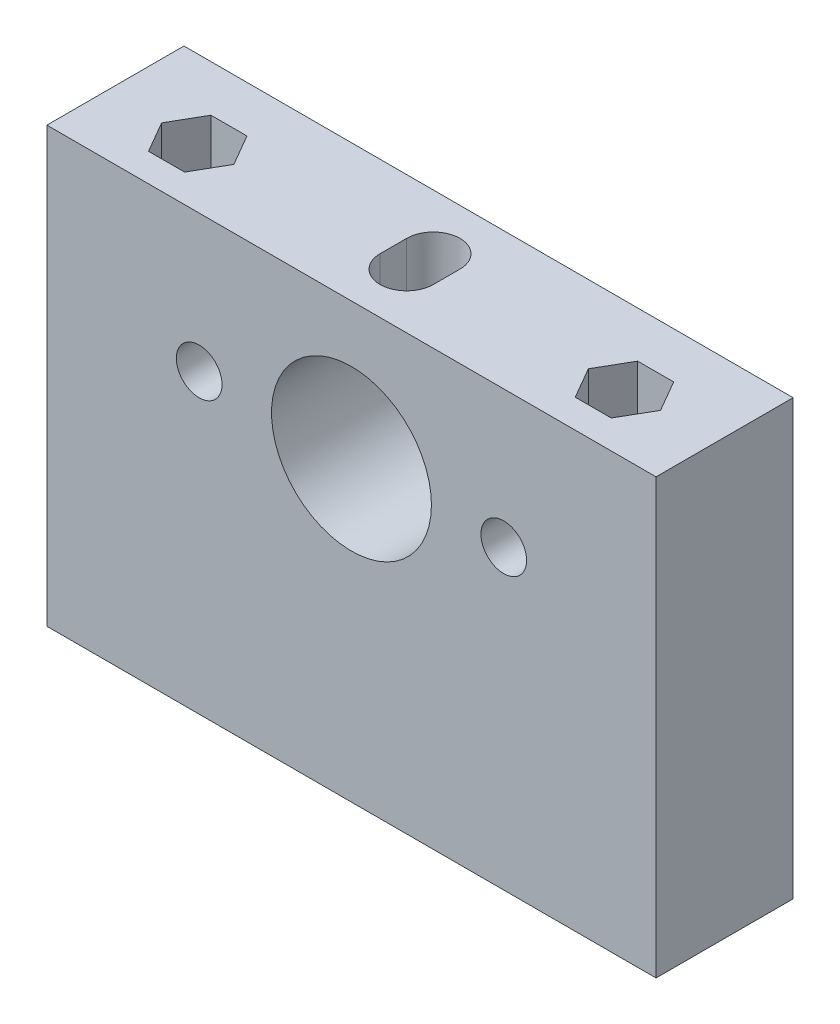
from build123d import *

# Parameters (mm, degrees)
SKETCH1_W           = 80
SKETCH1_H           = 18
SKETCH1_R           = 3
BOSS_EXTRUDE1_DEPTH = 20
SKETCH1_3_W         = 27.5
SKETCH1_3_H         = 18
SKETCH1_3_W_2       = 25
SKETCH1_3_R         = 3.5
BOSS_EXTRUDE2_DEPTH = 47
BOSS_EXTRUDE3_START = 47
SKETCH1_6_W         = 80
SKETCH1_6_H         = 18
BOSS_EXTRUDE3_DEPTH = 10
SKETCH2_R           = 5.5
SKETCH2_R_2         = 4.475
SKETCH2_R_3         = 3
BOSS_EXTRUDE4_DEPTH = 25
SKETCH2_6_R         = 10.5
SKETCH2_6_R_2       = 3
CUT_EXTRUDE5_DEPTH  = 161.097543738
SKETCH1_8_R         = 3
CUT_EXTRUDE6_DEPTH  = 57
CUT_EXTRUDE13_START = 27
SKETCH1_12_R        = 3
CUT_EXTRUDE13_DEPTH = 30
CUT_EXTRUDE14_START = -18
SKETCH2_7_W         = 9.3
SKETCH2_7_H         = 5
CUT_EXTRUDE14_DEPTH = 10


with BuildPart() as part:
    # Sketch1 → Boss-Extrude1 (new body)
    with BuildSketch(Plane(origin=(0, 0, 0), x_dir=(1, 0, 0), z_dir=(0, 1, 0))):
        with Locations((107.5033, -9)):
            Rectangle(SKETCH1_W, SKETCH1_H)
        with Locations(Location((135.5033, -10.15, 0), (0, 0, 270))):
            Circle(SKETCH1_R, mode=Mode.SUBTRACT)
        with Locations(Location((79.5033, -10.15, 0), (0, 0, 270))):
            Circle(SKETCH1_R, mode=Mode.SUBTRACT)
    extrude(amount=BOSS_EXTRUDE1_DEPTH)

    # Sketch1<3> → Boss-Extrude2 (add)
    # profile 1 of 11: a face of its own
    with BuildSketch(Plane(origin=(0, 0, 0), x_dir=(1, 0, 0), z_dir=(0, 1, 0))):
        with Locations((133.7533, -9)):
            Rectangle(SKETCH1_3_W, SKETCH1_3_H)
        Polygon((133.136163896, -6.05), (137.870436104, -6.05), (140.237572207, -10.15), (137.870436104, -14.25), (133.136163896, -14.25), (130.769027793, -10.15), align=None, mode=Mode.SUBTRACT)
    # profile 2 of 11: a face of its own
    with BuildSketch(Plane(origin=(0, 0, 0), x_dir=(1, 0, 0), z_dir=(0, 1, 0))):
        with Locations((81.2533, -9)):
            Rectangle(SKETCH1_3_W, SKETCH1_3_H)
        Polygon((81.88895579, -14.295097543), (77.154690915, -14.303429856), (74.780342483, -10.207602362), (77.140258926, -6.103442556), (81.874523801, -6.095110243), (84.248872233, -10.190937737), align=None, mode=Mode.SUBTRACT)
    # profile 3 of 11: a face of its own
    with BuildSketch(Plane(origin=(0, 0, 0), x_dir=(1, 0, 0), z_dir=(0, 1, 0))):
        with Locations((107.5033, -9)):
            Rectangle(SKETCH1_3_W_2, SKETCH1_3_H)
        with BuildLine():
            ThreePointArc((111.0033, -10.75), (107.5033, -14.25), (104.0033, -10.75))
            Line((104.0033, -10.75), (104.0033, -7.25))
            ThreePointArc((104.0033, -7.25), (107.5033, -3.75), (111.0033, -7.25))
            Line((111.0033, -7.25), (111.0033, -10.75))
        make_face(mode=Mode.SUBTRACT)
    # profile 4 of 11: a face of its own
    with BuildSketch(Plane(origin=(0, 0, 0), x_dir=(1, 0, 0), z_dir=(0, 1, 0))):
        with Locations((107.5033, -10.75)):
            Circle(SKETCH1_3_R)
    # profile 5 of 11: a face of its own
    with BuildSketch(Plane(origin=(0, 0, 0), x_dir=(1, 0, 0), z_dir=(0, 1, 0))):
        with Locations((107.5033, -7.25)):
            Circle(SKETCH1_3_R)
    # profile 6 of 11: a face of its own
    with BuildSketch(Plane(origin=(0, 0, 0), x_dir=(1, 0, 0), z_dir=(0, 1, 0))):
        with Locations((107.5033, -7.25)):
            Circle(SKETCH1_3_R)
    # profile 7 of 11: a face of its own
    with BuildSketch(Plane(origin=(0, 0, 0), x_dir=(1, 0, 0), z_dir=(0, 1, 0))):
        with Locations((107.5033, -10.75)):
            Circle(SKETCH1_3_R)
    # profile 8 of 11: a face of its own
    with BuildSketch(Plane(origin=(0, 0, 0), x_dir=(1, 0, 0), z_dir=(0, 1, 0))):
        with BuildLine():
            Line((104.0033, -7.25), (104.0033, -10.75))
            ThreePointArc((104.0033, -10.75), (104.122559608, -9.844133342), (104.472211087, -9))
            ThreePointArc((104.472211087, -9), (104.122559608, -8.155866658), (104.0033, -7.25))
        make_face()
    # profile 9 of 11: a face of its own
    with BuildSketch(Plane(origin=(0, 0, 0), x_dir=(1, 0, 0), z_dir=(0, 1, 0))):
        with BuildLine():
            ThreePointArc((110.534388913, -9), (110.884040392, -9.844133342), (111.0033, -10.75))
            Line((111.0033, -10.75), (111.0033, -7.25))
            ThreePointArc((111.0033, -7.25), (110.884040392, -8.155866658), (110.534388913, -9))
        make_face()
    # profile 10 of 11: a face of its own
    with BuildSketch(Plane(origin=(0, 0, 0), x_dir=(1, 0, 0), z_dir=(0, 1, 0))):
        with Locations((107.5033, -10.75)):
            Circle(SKETCH1_3_R)
    # profile 11 of 11: a face of its own
    with BuildSketch(Plane(origin=(0, 0, 0), x_dir=(1, 0, 0), z_dir=(0, 1, 0))):
        with Locations((107.5033, -7.25)):
            Circle(SKETCH1_3_R)
    extrude(amount=BOSS_EXTRUDE2_DEPTH)

    # Sketch1<6> → Boss-Extrude3 (add)
    with BuildSketch(Plane(origin=(0, 0, 0), x_dir=(1, 0, 0), z_dir=(0, 1, 0)).offset(BOSS_EXTRUDE3_START)):
        with Locations((107.5033, -9)):
            Rectangle(SKETCH1_6_W, SKETCH1_6_H)
        Polygon((133.136163896, -6.05), (137.870436104, -6.05), (140.237572207, -10.15), (137.870436104, -14.25), (133.136163896, -14.25), (130.769027793, -10.15), align=None, mode=Mode.SUBTRACT)
        with BuildLine():
            Line((104.0033, -10.75), (104.0033, -7.25))
            ThreePointArc((104.0033, -7.25), (107.5033, -3.75), (111.0033, -7.25))
            Line((111.0033, -7.25), (111.0033, -10.75))
            ThreePointArc((111.0033, -10.75), (107.5033, -14.25), (104.0033, -10.75))
        make_face(mode=Mode.SUBTRACT)
        Polygon((77.154690915, -14.303429856), (74.780342483, -10.207602362), (77.140258926, -6.103442556), (81.874523801, -6.095110243), (84.248872233, -10.190937737), (81.88895579, -14.295097543), align=None, mode=Mode.SUBTRACT)
    extrude(amount=BOSS_EXTRUDE3_DEPTH)

    # Sketch2 → Boss-Extrude4 (add)
    # profile 1 of 4: a face of its own
    with BuildSketch(Plane.XY.offset(18)):
        with Locations((87.5033, 38.99)):
            Circle(SKETCH2_R)
        with Locations((87.5033, 38.99)):
            Circle(SKETCH2_R_2, mode=Mode.SUBTRACT)
    # profile 2 of 4: a face of its own
    with BuildSketch(Plane.XY.offset(18)):
        with Locations((87.5033, 38.99)):
            Circle(SKETCH2_R_2)
        with Locations((87.5033, 38.99)):
            Circle(SKETCH2_R_3, mode=Mode.SUBTRACT)
    # profile 3 of 4: a face of its own
    with BuildSketch(Plane.XY.offset(18)):
        with Locations((127.5033, 38.99)):
            Circle(SKETCH2_R)
        with Locations((127.5033, 38.99)):
            Circle(SKETCH2_R_2, mode=Mode.SUBTRACT)
    # profile 4 of 4: a face of its own
    with BuildSketch(Plane.XY.offset(18)):
        with Locations((127.5033, 38.99)):
            Circle(SKETCH2_R_2)
        with Locations((127.5033, 38.99)):
            Circle(SKETCH2_R_3, mode=Mode.SUBTRACT)
    extrude(amount=-BOSS_EXTRUDE4_DEPTH)

    # Sketch2<6> → Cut-Extrude5 (cut, through all)
    with BuildSketch(Plane.XY.offset(18)):
        with Locations((107.5033, 39.05)):
            Circle(SKETCH2_6_R)
        with Locations((87.5033, 38.99)):
            Circle(SKETCH2_6_R_2)
        with Locations((127.5033, 38.99)):
            Circle(SKETCH2_6_R_2)
    extrude(amount=-CUT_EXTRUDE5_DEPTH, mode=Mode.SUBTRACT)

    # Sketch1<8> → Cut-Extrude6 (cut)
    with BuildSketch(Plane(origin=(0, 0, 0), x_dir=(1, 0, 0), z_dir=(0, 1, 0))):
        with Locations(Location((135.5033, -10.15, 0), (0, 0, 270))):
            Circle(SKETCH1_8_R)
        with Locations(Location((79.5033, -10.15, 0), (0, 0, 270))):
            Circle(SKETCH1_8_R)
    extrude(amount=CUT_EXTRUDE6_DEPTH, mode=Mode.SUBTRACT)

    # Sketch1<12> → Cut-Extrude13 (cut)
    # profile 1 of 2: a face of its own
    with BuildSketch(Plane(origin=(0, 0, 0), x_dir=(1, 0, 0), z_dir=(0, 1, 0)).offset(CUT_EXTRUDE13_START)):
        Polygon((137.870436104, -14.25), (140.237572207, -10.15), (137.870436104, -6.05), (133.136163896, -6.05), (130.769027793, -10.15), (133.136163896, -14.25), align=None)
        with Locations(Location((135.5033, -10.15, 0), (0, 0, 270))):
            Circle(SKETCH1_12_R, mode=Mode.SUBTRACT)
    # profile 2 of 2: a face of its own
    with BuildSketch(Plane(origin=(0, 0, 0), x_dir=(1, 0, 0), z_dir=(0, 1, 0)).offset(CUT_EXTRUDE13_START)):
        Polygon((77.140258926, -6.103442556), (81.874523801, -6.095110243), (84.248872233, -10.190937737), (81.88895579, -14.295097543), (77.154690915, -14.303429856), (74.780342483, -10.207602362), align=None)
        with Locations(Location((79.5033, -10.15, 0), (0, 0, 270))):
            Circle(SKETCH1_12_R, mode=Mode.SUBTRACT)
    extrude(amount=CUT_EXTRUDE13_DEPTH, mode=Mode.SUBTRACT)

    # Sketch2<7> → Cut-Extrude14 (cut)
    with BuildSketch(Plane.XY.offset(18).offset(CUT_EXTRUDE14_START)):
        with Locations((79.5033, 28.5)):
            Rectangle(SKETCH2_7_W, SKETCH2_7_H)
        with Locations((135.5033, 28.5)):
            Rectangle(SKETCH2_7_W, SKETCH2_7_H)
    extrude(amount=CUT_EXTRUDE14_DEPTH, mode=Mode.SUBTRACT)


solid = part.part
